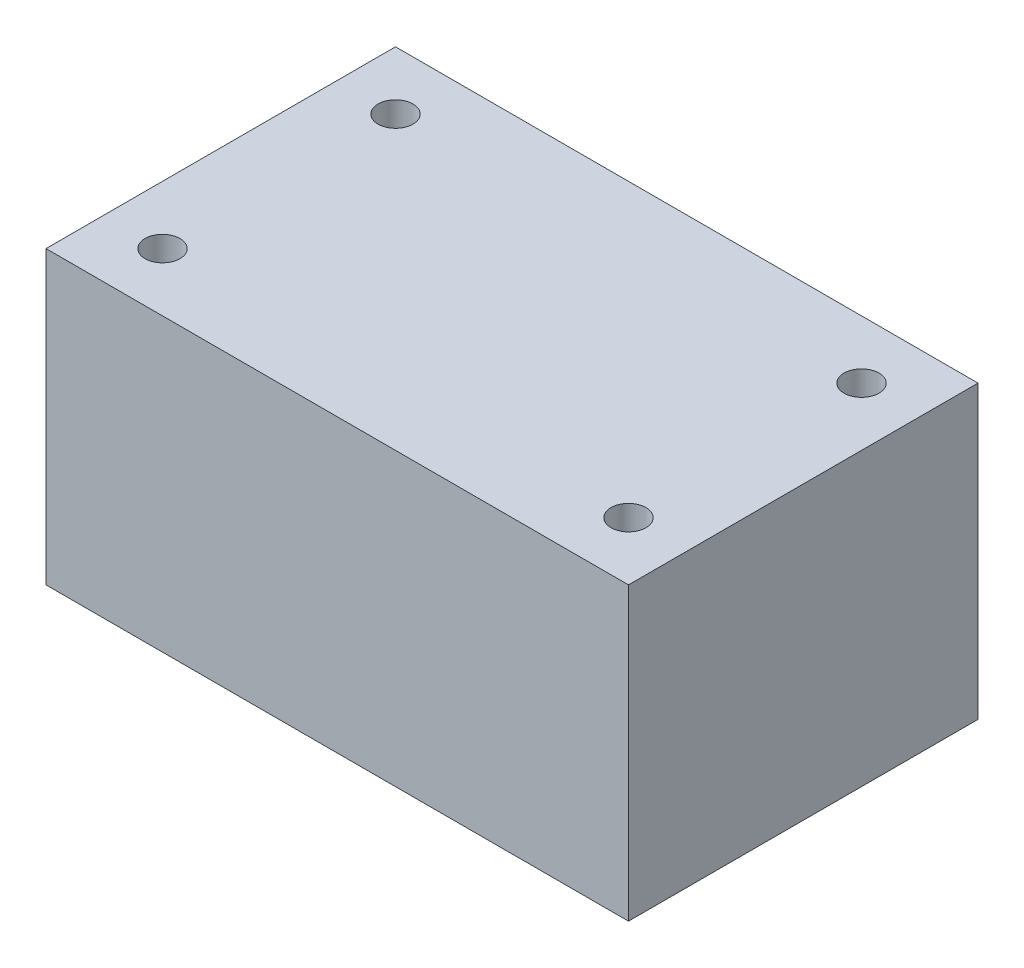
from build123d import *

# Parameters (mm, degrees)
ESQUISSE1_W        = 50
ESQUISSE1_H        = 30
ESQUISSE1_R        = 1.5
BOSS_EXTRU_1_DEPTH = 25


with BuildPart() as part:
    # Esquisse1 → Boss.-Extru.1 (new body)
    with BuildSketch(Plane(origin=(0, 0, 0), x_dir=(1, 0, 0), z_dir=(0, 1, 0))):
        Rectangle(ESQUISSE1_W, ESQUISSE1_H)
        with Locations((-20, 10)):
            Circle(ESQUISSE1_R, mode=Mode.SUBTRACT)
        with Locations((-20, -10)):
            Circle(ESQUISSE1_R, mode=Mode.SUBTRACT)
        with Locations((20, -10)):
            Circle(ESQUISSE1_R, mode=Mode.SUBTRACT)
        with Locations((20, 10)):
            Circle(ESQUISSE1_R, mode=Mode.SUBTRACT)
    extrude(amount=BOSS_EXTRU_1_DEPTH)


solid = part.part
